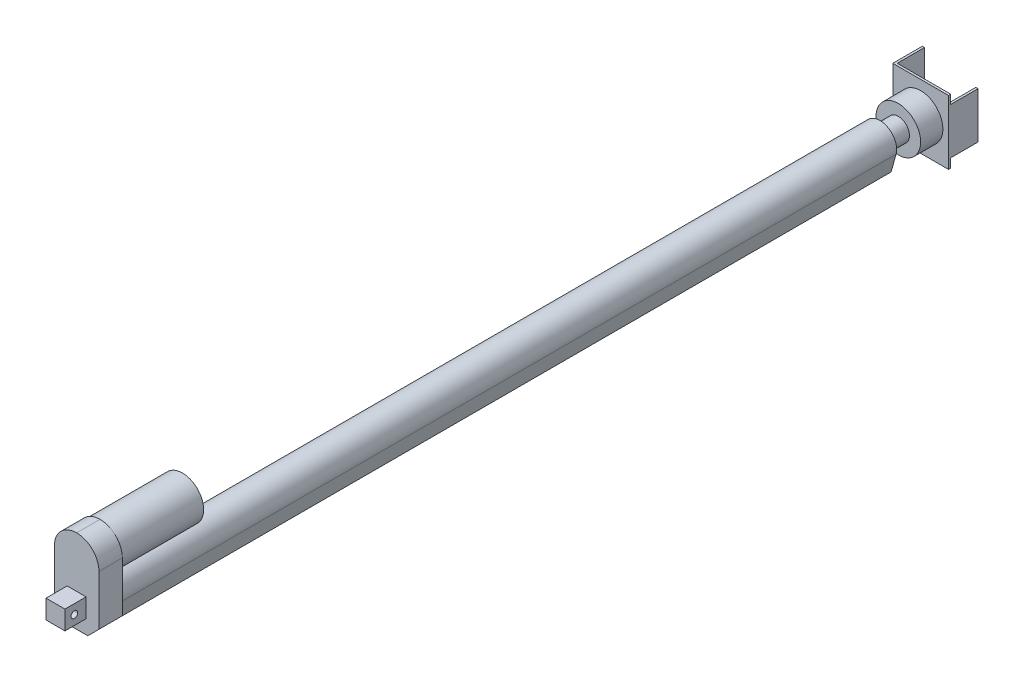
from build123d import *

# Parameters (mm, degrees)
SKETCH_1_W          = 40
SKETCH_1_H          = 75
EXTRUDE_1_DEPTH     = 21
FILLET_1_R          = 20
CHAMFER_1_SIZE      = 10
EXTRUDE_2_DEPTH     = 700
SKETCH_3_R          = 19
EXTRUDE_4_DEPTH     = 74
SKETCH_4_W          = 17
SKETCH_4_H          = 17
EXTRUDE_5_DEPTH     = 19
SKETCH_5_R          = 3
CUT_EXTRUDE_1_DEPTH = 19
SKETCH_6_R          = 10
EXTRUDE_6_DEPTH     = 16.5
SKETCH_7_R          = 20
EXTRUDE_7_DEPTH     = 20
SKETCH_8_W          = 50
SKETCH_8_H          = 57.5
EXTRUDE_8_DEPTH     = 2
SKETCH_9_W          = 2
SKETCH_9_H          = 57.5
EXTRUDE_9_DEPTH     = 24.5
SKETCH_10_W         = 2
SKETCH_10_H         = 41.5
EXTRUDE_10_DEPTH    = 24.5


with BuildPart() as part:
    # 草图1 → 凸台-拉伸1 (new body)
    with BuildSketch(Plane.XY):
        Rectangle(SKETCH_1_W, SKETCH_1_H)
    extrude(amount=EXTRUDE_1_DEPTH)

    # 圆角1
    fillet_1_edges = [part.edges().sort_by_distance(p)[0] for p in [
        (-20, 37.5, 10.5),
        (20, 37.5, 10.5),
    ]]
    fillet(fillet_1_edges, radius=FILLET_1_R - 0.0001)  # a hair under: the kernel refuses the full size

    # 倒角1
    chamfer_1_edges = [part.edges().sort_by_distance(p)[0] for p in [
        (20, -37.5, 10.5),
        (-20, -37.5, 10.5),
    ]]
    chamfer(chamfer_1_edges, length=CHAMFER_1_SIZE)

    # 草图2 → 凸台-拉伸2 (add)
    with BuildSketch(Plane(origin=(0, 0, 0), x_dir=(-1, 0, 0), z_dir=(0, 0, -1))):
        with BuildLine():
            Line((-10, -37.5), (10, -37.5))
            Line((10, -37.5), (14.449874371, -21.525062814))
            ThreePointArc((14.449874371, -21.525062814), (0, -2.5), (-14.449874371, -21.525062814))
            Line((-14.449874371, -21.525062814), (-10, -37.5))
        make_face()
    extrude(amount=EXTRUDE_2_DEPTH)

    # 草图3 → 凸台-拉伸4 (add)
    with BuildSketch(Plane(origin=(0, 0, 0), x_dir=(-1, 0, 0), z_dir=(0, 0, -1))):
        with Locations(Location((0, 17.5, 0), (0, 0, 180))):
            Circle(SKETCH_3_R)
    extrude(amount=EXTRUDE_4_DEPTH)

    # 草图4 → 凸台-拉伸5 (add)
    with BuildSketch(Plane.XY.offset(21)):
        with Locations((0, -16.5)):
            Rectangle(SKETCH_4_W, SKETCH_4_H)
    extrude(amount=EXTRUDE_5_DEPTH)

    # 草图5 → 切除-拉伸1 (cut)
    with BuildSketch(Plane.ZY.offset(8.5)):
        with Locations(Location((31.5, -16.5, 0), (0, 0, 270))):
            Circle(SKETCH_5_R)
    extrude(amount=-CUT_EXTRUDE_1_DEPTH, mode=Mode.SUBTRACT)

    # 草图6 → 凸台-拉伸6 (add)
    with BuildSketch(Plane(origin=(0, 0, -700), x_dir=(-1, 0, 0), z_dir=(0, 0, -1))):
        with Locations((0, -17.5)):
            Circle(SKETCH_6_R)
    extrude(amount=EXTRUDE_6_DEPTH)

    # 草图7 → 凸台-拉伸7 (add)
    with BuildSketch(Plane(origin=(0, 0, -716.5), x_dir=(-1, 0, 0), z_dir=(0, 0, -1))):
        with Locations((0, -17.5)):
            Circle(SKETCH_7_R)
    extrude(amount=EXTRUDE_7_DEPTH)

    # 草图8 → 凸台-拉伸8 (add)
    with BuildSketch(Plane(origin=(0, 0, -736.5), x_dir=(-1, 0, 0), z_dir=(0, 0, -1))):
        with Locations((0, -17.5)):
            Rectangle(SKETCH_8_W, SKETCH_8_H)
    extrude(amount=EXTRUDE_8_DEPTH)

    # 草图9 → 凸台-拉伸9 (add)
    with BuildSketch(Plane(origin=(0, 0, -738.5), x_dir=(-1, 0, 0), z_dir=(0, 0, -1))):
        with Locations((24, -17.5)):
            Rectangle(SKETCH_9_W, SKETCH_9_H)
    extrude(amount=EXTRUDE_9_DEPTH)

    # 草图10 → 凸台-拉伸10 (add)
    with BuildSketch(Plane(origin=(0, 0, -738.5), x_dir=(-1, 0, 0), z_dir=(0, 0, -1))):
        with Locations((-24, -17.5)):
            Rectangle(SKETCH_10_W, SKETCH_10_H)
    extrude(amount=EXTRUDE_10_DEPTH)


solid = part.part
